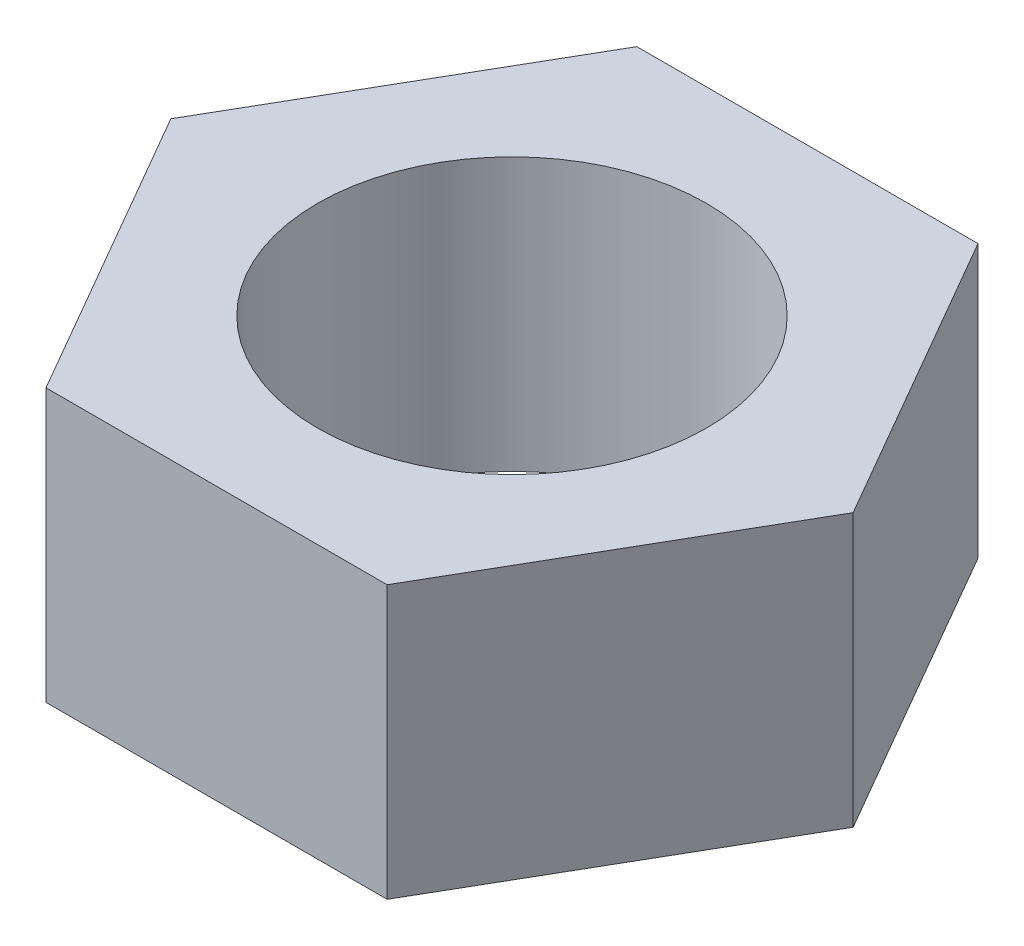
from build123d import *

# Parameters (mm, degrees)
SKETCH1_R           = 5.5
BOSS_EXTRUDE1_DEPTH = 7.7


with BuildPart() as part:
    # Sketch1 → Boss-Extrude1 (new body)
    with BuildSketch(Plane(origin=(0, 0, 0), x_dir=(1, 0, 0), z_dir=(0, 1, 0))):
        Polygon((4.820874748, -8.35), (9.641749495, 0), (4.820874748, 8.35), (-4.820874748, 8.35), (-9.641749495, 0), (-4.820874748, -8.35), align=None)
        Circle(SKETCH1_R, mode=Mode.SUBTRACT)
    extrude(amount=BOSS_EXTRUDE1_DEPTH)


solid = part.part
